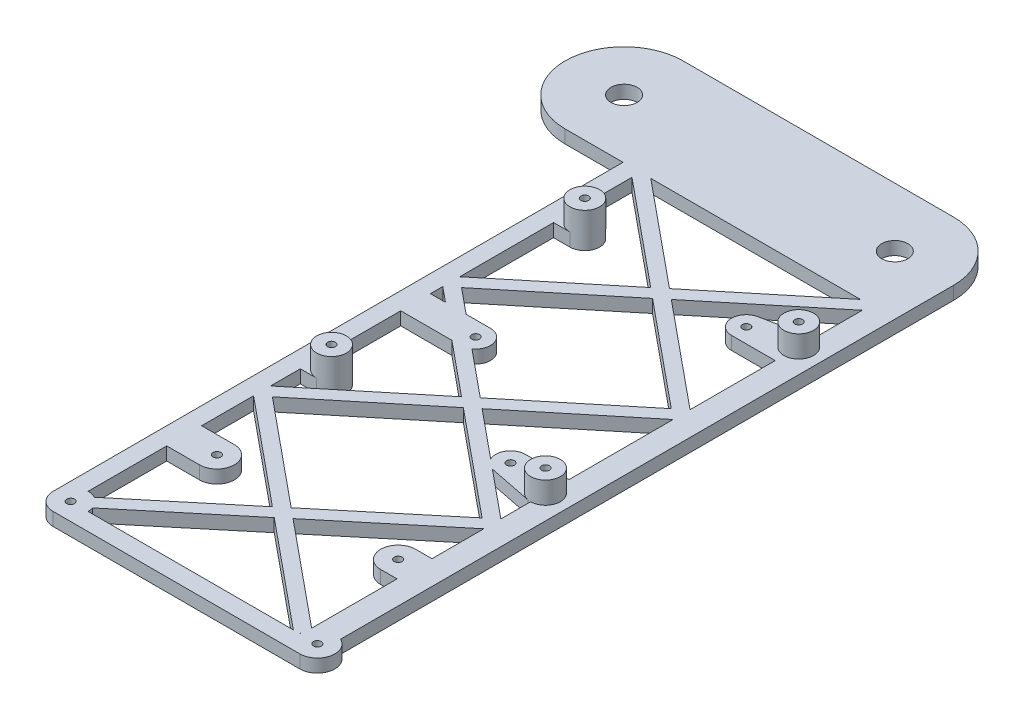
from build123d import *

# Parameters (mm, degrees)
SKETCH2_R                       = 3
SHIFTER_HOLE_IF_DEPTH           = 3
RPI4_SCREW_BOSSES_DEPTH         = 5
RPI4_SCREW_BOSSES_DEPTH_BACK    = 3
SKETCH3_R                       = 3.4
SKETCH3_R_2                     = 0.9
RPI4_SCREW_BOSSES_2_DEPTH       = 5
RPI4_SCREW_BOSSES_2_DEPTH_BACK  = 3
RPI4_SCREW_BOSSES_3_DEPTH       = 5
RPI4_SCREW_BOSSES_3_DEPTH_BACK  = 3
RPI4_SCREW_BOSSES_4_DEPTH       = 5
RPI4_SCREW_BOSSES_4_DEPTH_BACK  = 3
SKETCH4_R                       = 3.4
SKETCH4_R_2                     = 0.9
CAN_SWITCH_SCREW_BOSSES_DEPTH   = 3
CAN_SWITCH_SCREW_BOSSES_2_DEPTH = 3
CAN_SWITCH_SCREW_BOSSES_3_DEPTH = 3
SKETCH5_R                       = 4
SKETCH5_R_2                     = 0.9
F_5V_REG_MOUNT_POSTS_DEPTH      = 3
F_5V_REG_MOUNT_POSTS_2_DEPTH    = 3
F_5V_REG_MOUNT_POSTS_3_DEPTH    = 3
F_5V_REG_MOUNT_POSTS_4_DEPTH    = 3
SKETCH6_R                       = 0.9
IF_LINK_DEPTH                   = 3
WEIGHT_RELIEF_DEPTH             = 125.094721886
WEIGHT_RELIEF_DEPTH_BACK        = 125.094721886
RIBBING_DEPTH                   = 3


with BuildPart() as part:
    # Sketch2 → SHIFTER HOLE IF (new body)
    with BuildSketch(Plane(origin=(0, -50.5, 0), x_dir=(1, 0, 0), z_dir=(0, 1, 0))):
        with BuildLine():
            Line((-50, 106.5), (12, 106.5))
            ThreePointArc((12, 106.5), (25.5, 93), (12, 79.5))
            Line((12, 79.5), (-50, 79.5))
            ThreePointArc((-50, 79.5), (-63.5, 93), (-50, 106.5))
        make_face()
        with Locations((-50, 93)):
            Circle(SKETCH2_R, mode=Mode.SUBTRACT)
        with Locations((12, 93)):
            Circle(SKETCH2_R, mode=Mode.SUBTRACT)
    extrude(amount=-SHIFTER_HOLE_IF_DEPTH)



with BuildPart() as body_2:
    # Sketch3 → RPI4 SCREW BOSSES (new, two sides: drawn at the far end of the back side and taken through both)
    with BuildSketch(Plane(origin=(0, -50.5, 0), x_dir=(1, 0, 0), z_dir=(0, 1, 0)).offset(-RPI4_SCREW_BOSSES_DEPTH_BACK)):
        with Locations((-29, 63)):
            Circle(SKETCH3_R)
        with Locations((-29, 63)):
            Circle(SKETCH3_R_2, mode=Mode.SUBTRACT)
    extrude(amount=RPI4_SCREW_BOSSES_DEPTH + RPI4_SCREW_BOSSES_DEPTH_BACK)


with BuildPart() as body_3:
    # Sketch3 → RPI4 SCREW BOSSES 2 (new, two sides: drawn at the far end of the back side and taken through both)
    with BuildSketch(Plane(origin=(0, -50.5, 0), x_dir=(1, 0, 0), z_dir=(0, 1, 0)).offset(-RPI4_SCREW_BOSSES_2_DEPTH_BACK)):
        with Locations((20, 63)):
            Circle(SKETCH3_R)
        with Locations((20, 63)):
            Circle(SKETCH3_R_2, mode=Mode.SUBTRACT)
    extrude(amount=RPI4_SCREW_BOSSES_2_DEPTH + RPI4_SCREW_BOSSES_2_DEPTH_BACK)


with BuildPart() as body_4:
    # Sketch3 → RPI4 SCREW BOSSES 3 (new, two sides: drawn at the far end of the back side and taken through both)
    with BuildSketch(Plane(origin=(0, -50.5, 0), x_dir=(1, 0, 0), z_dir=(0, 1, 0)).offset(-RPI4_SCREW_BOSSES_3_DEPTH_BACK)):
        with Locations((20, 5)):
            Circle(SKETCH3_R)
        with Locations((20, 5)):
            Circle(SKETCH3_R_2, mode=Mode.SUBTRACT)
    extrude(amount=RPI4_SCREW_BOSSES_3_DEPTH + RPI4_SCREW_BOSSES_3_DEPTH_BACK)


with BuildPart() as body_5:
    # Sketch3 → RPI4 SCREW BOSSES 4 (new, two sides: drawn at the far end of the back side and taken through both)
    with BuildSketch(Plane(origin=(0, -50.5, 0), x_dir=(1, 0, 0), z_dir=(0, 1, 0)).offset(-RPI4_SCREW_BOSSES_4_DEPTH_BACK)):
        with Locations((-29, 5)):
            Circle(SKETCH3_R)
        with Locations((-29, 5)):
            Circle(SKETCH3_R_2, mode=Mode.SUBTRACT)
    extrude(amount=RPI4_SCREW_BOSSES_4_DEPTH + RPI4_SCREW_BOSSES_4_DEPTH_BACK)


with BuildPart() as body_6:
    # Sketch4 → CAN SWITCH SCREW BOSSES (new body)
    with BuildSketch(Plane(origin=(0, -50.5, 0), x_dir=(1, 0, 0), z_dir=(0, 1, 0))):
        with Locations((10, 61)):
            Circle(SKETCH4_R)
        with Locations((10, 61)):
            Circle(SKETCH4_R_2, mode=Mode.SUBTRACT)
    extrude(amount=-CAN_SWITCH_SCREW_BOSSES_DEPTH)


with BuildPart() as body_7:
    # Sketch4 → CAN SWITCH SCREW BOSSES 2 (new body)
    with BuildSketch(Plane(origin=(0, -50.5, 0), x_dir=(1, 0, 0), z_dir=(0, 1, 0))):
        with Locations((10, 7)):
            Circle(SKETCH4_R)
        with Locations((10, 7)):
            Circle(SKETCH4_R_2, mode=Mode.SUBTRACT)
    extrude(amount=-CAN_SWITCH_SCREW_BOSSES_2_DEPTH)


with BuildPart() as body_8:
    # Sketch4 → CAN SWITCH SCREW BOSSES 3 (new body)
    with BuildSketch(Plane(origin=(0, -50.5, 0), x_dir=(1, 0, 0), z_dir=(0, 1, 0))):
        with Locations((-19, 28)):
            Circle(SKETCH4_R)
        with Locations((-19, 28)):
            Circle(SKETCH4_R_2, mode=Mode.SUBTRACT)
    extrude(amount=-CAN_SWITCH_SCREW_BOSSES_3_DEPTH)


with BuildPart() as body_9:
    # Sketch5 → 5V REG MOUNT POSTS (new body)
    with BuildSketch(Plane(origin=(0, -50.5, 0), x_dir=(1, 0, 0), z_dir=(0, 1, 0))):
        with Locations((-32.75, -51)):
            Circle(SKETCH5_R)
        with Locations((-32.75, -51)):
            Circle(SKETCH5_R_2, mode=Mode.SUBTRACT)
    extrude(amount=-F_5V_REG_MOUNT_POSTS_DEPTH)


with BuildPart() as body_10:
    # Sketch5 → 5V REG MOUNT POSTS 2 (new body)
    with BuildSketch(Plane(origin=(0, -50.5, 0), x_dir=(1, 0, 0), z_dir=(0, 1, 0))):
        with Locations((-25.25, -25)):
            Circle(SKETCH5_R)
        with Locations((-25.25, -25)):
            Circle(SKETCH5_R_2, mode=Mode.SUBTRACT)
    extrude(amount=-F_5V_REG_MOUNT_POSTS_2_DEPTH)


with BuildPart() as body_11:
    # Sketch5 → 5V REG MOUNT POSTS 3 (new body)
    with BuildSketch(Plane(origin=(0, -50.5, 0), x_dir=(1, 0, 0), z_dir=(0, 1, 0))):
        with Locations((16.25, -25)):
            Circle(SKETCH5_R)
        with Locations((16.25, -25)):
            Circle(SKETCH5_R_2, mode=Mode.SUBTRACT)
    extrude(amount=-F_5V_REG_MOUNT_POSTS_3_DEPTH)


with BuildPart() as body_12:
    # Sketch5 → 5V REG MOUNT POSTS 4 (new body)
    with BuildSketch(Plane(origin=(0, -50.5, 0), x_dir=(1, 0, 0), z_dir=(0, 1, 0))):
        with Locations((23.75, -51)):
            Circle(SKETCH5_R)
        with Locations((23.75, -51)):
            Circle(SKETCH5_R_2, mode=Mode.SUBTRACT)
    extrude(amount=-F_5V_REG_MOUNT_POSTS_4_DEPTH)


with BuildPart() as part_1:
    add(part.part)

    add(body_2.part)  # IF LINK merges body 2

    add(body_3.part)  # IF LINK merges body 3

    add(body_4.part)  # IF LINK merges body 4

    add(body_5.part)  # IF LINK merges body 5

    add(body_6.part)  # IF LINK merges body 6

    add(body_7.part)  # IF LINK merges body 7

    add(body_8.part)  # IF LINK merges body 8

    add(body_9.part)  # IF LINK merges body 9

    add(body_10.part)  # IF LINK merges body 10

    add(body_11.part)  # IF LINK merges body 11

    add(body_12.part)  # IF LINK merges body 12
    # Sketch6 → IF LINK (add)
    with BuildSketch(Plane(origin=(0, -50.5, 0), x_dir=(1, 0, 0), z_dir=(0, 1, 0))):
        with BuildLine():
            Line((25.5, 93), (25.5, -47.403126358))
            ThreePointArc((25.5, -47.403126358), (27.647915762, -51.897915762), (23.75, -55))
            Line((23.75, -55), (-32.75, -55))
            ThreePointArc((-32.75, -55), (-35.578427125, -53.828427125), (-36.75, -51))
            Line((-36.75, -51), (-36.75, 79.5))
            Line((-36.75, 79.5), (12, 79.5))
            ThreePointArc((12, 79.5), (21.545941546, 83.454058454), (25.5, 93))
        make_face()
        with Locations((-25.25, -25)):
            Circle(SKETCH6_R, mode=Mode.SUBTRACT)
        with Locations((16.25, -25)):
            Circle(SKETCH6_R, mode=Mode.SUBTRACT)
        with Locations((23.75, -51)):
            Circle(SKETCH6_R, mode=Mode.SUBTRACT)
        with Locations((-32.75, -51)):
            Circle(SKETCH6_R, mode=Mode.SUBTRACT)
        with Locations((-29, 63)):
            Circle(SKETCH6_R, mode=Mode.SUBTRACT)
        with Locations((20, 63)):
            Circle(SKETCH6_R, mode=Mode.SUBTRACT)
        with Locations((10, 61)):
            Circle(SKETCH6_R, mode=Mode.SUBTRACT)
        with Locations((-19, 28)):
            Circle(SKETCH6_R, mode=Mode.SUBTRACT)
        with Locations((10, 7)):
            Circle(SKETCH6_R, mode=Mode.SUBTRACT)
        with Locations((20, 5)):
            Circle(SKETCH6_R, mode=Mode.SUBTRACT)
        with Locations((-29, 5)):
            Circle(SKETCH6_R, mode=Mode.SUBTRACT)
    extrude(amount=-IF_LINK_DEPTH)

    # Sketch7 → WEIGHT RELIEF (cut, two sides: drawn at the far end of the back side and taken through both)
    with BuildSketch(Plane(origin=(0, -50.5, 0), x_dir=(1, 0, 0), z_dir=(0, 1, 0)).offset(-WEIGHT_RELIEF_DEPTH_BACK)):
        with BuildLine():
            Line((-32.75, 66.4), (-32.75, 79.5))
            Line((-32.75, 79.5), (20, 79.5))
            Line((20, 79.5), (20, 66.4))
            ThreePointArc((20, 66.4), (19.664972099, 66.383453311), (19.333205141, 66.333974297))
            Line((19.333205141, 66.333974297), (9.333205141, 64.333974297))
            ThreePointArc((9.333205141, 64.333974297), (6.616546689, 60.664972099), (10, 57.6))
            Line((10, 57.6), (20, 57.6))
            Line((20, 57.6), (20, 10.4))
            Line((20, 10.4), (10, 10.4))
            ThreePointArc((10, 10.4), (6.616546689, 7.335027901), (9.333205141, 3.666025703))
            Line((9.333205141, 3.666025703), (19.333205141, 1.666025703))
            ThreePointArc((19.333205141, 1.666025703), (19.664972099, 1.616546689), (20, 1.6))
            Line((20, 1.6), (20, -21))
            Line((20, -21), (16.25, -21))
            ThreePointArc((16.25, -21), (12.25, -25), (16.25, -29))
            Line((16.25, -29), (20, -29))
            Line((20, -29), (20, -49.608058909))
            ThreePointArc((20, -49.608058909), (19.812996063, -50.292893219), (19.75, -51))
            Line((19.75, -51), (-28.75, -51))
            ThreePointArc((-28.75, -51), (-29.921572875, -48.171572875), (-32.75, -47))
            Line((-32.75, -47), (-32.75, -29))
            Line((-32.75, -29), (-25.25, -29))
            ThreePointArc((-25.25, -29), (-21.25, -25), (-25.25, -21))
            Line((-25.25, -21), (-32.75, -21))
            Line((-32.75, -21), (-32.75, 1.6))
            Line((-32.75, 1.6), (-29, 1.6))
            ThreePointArc((-29, 1.6), (-25.6, 5), (-29, 8.4))
            Line((-29, 8.4), (-32.75, 8.4))
            Line((-32.75, 8.4), (-32.75, 24.6))
            Line((-32.75, 24.6), (-19, 24.6))
            ThreePointArc((-19, 24.6), (-15.6, 28), (-19, 31.4))
            Line((-19, 31.4), (-32.75, 31.4))
            Line((-32.75, 31.4), (-32.75, 59.6))
            Line((-32.75, 59.6), (-29, 59.6))
            ThreePointArc((-29, 59.6), (-25.6, 63), (-29, 66.4))
            Line((-29, 66.4), (-32.75, 66.4))
        make_face()
    extrude(amount=WEIGHT_RELIEF_DEPTH + WEIGHT_RELIEF_DEPTH_BACK, mode=Mode.SUBTRACT)

    # Sketch8 → RIBBING (add)
    with BuildSketch(Plane(origin=(0, -50.5, 0), x_dir=(1, 0, 0), z_dir=(0, 1, 0))):
        Polygon((-33.702148182, 78.340942694), (17.636922443, 36.166666667), (-35.113077557, -7.166666667), (19.047851818, -51.659057306), (20.952148182, -49.340942694), (-30.386922443, -7.166666667), (22.363077557, 36.166666667), (-31.797851818, 80.659057306), align=None)
        Polygon((19.047851818, 80.659057306), (-35.113077557, 36.166666667), (17.644997002, -7.173299796), (-33.016457075, -49.271127354), (-31.099132571, -51.578477944), (22.355002998, -7.160033538), (-30.386922443, 36.166666667), (20.952148182, 78.340942694), align=None)
    extrude(amount=-RIBBING_DEPTH)


solid = part_1.part
